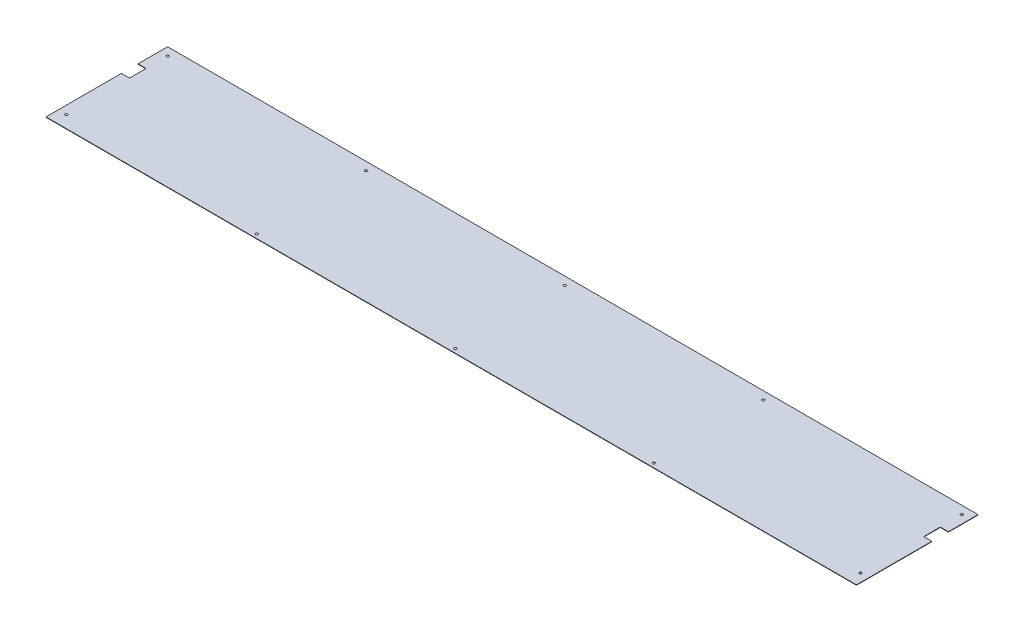
from build123d import *

# Parameters (mm, degrees)
SKETCH1_R           = 3
BOSS_EXTRUDE1_DEPTH = 1
CHAMFER1_SIZE       = 1


with BuildPart() as part:
    # Sketch1 → Boss-Extrude1 (new body)
    with BuildSketch(Plane(origin=(0, 0, 0), x_dir=(1, 0, 0), z_dir=(0, 1, 0))):
        Polygon((-1000, 88.5), (-980, 88.5), (-980, 47.5), (-1000, 47.5), (-1000, -138.5), (1000, -138.5), (1000, 47.5), (980, 47.5), (980, 88.5), (1000, 88.5), (1000, 158.5), (1000, 161.5), (-1000, 161.5), (-1000, 158.5), align=None)
        with Locations(Location((-980, 141.5, 0), (0, 0, 270))):
            Circle(SKETCH1_R, mode=Mode.SUBTRACT)
        with Locations(Location((980, 141.5, 0), (0, 0, 270))):
            Circle(SKETCH1_R, mode=Mode.SUBTRACT)
        with Locations(Location((0, 141.5, 0), (0, 0, 270))):
            Circle(SKETCH1_R, mode=Mode.SUBTRACT)
        with Locations(Location((490, 141.5, 0), (0, 0, 270))):
            Circle(SKETCH1_R, mode=Mode.SUBTRACT)
        with Locations(Location((-490, 141.5, 0), (0, 0, 270))):
            Circle(SKETCH1_R, mode=Mode.SUBTRACT)
        with Locations(Location((490, -128.5, 0), (0, 0, 270))):
            Circle(SKETCH1_R, mode=Mode.SUBTRACT)
        with Locations(Location((980, -108.5, 0), (0, 0, 270))):
            Circle(SKETCH1_R, mode=Mode.SUBTRACT)
        with Locations(Location((0, -128.5, 0), (0, 0, 270))):
            Circle(SKETCH1_R, mode=Mode.SUBTRACT)
        with Locations(Location((-490, -128.5, 0), (0, 0, 270))):
            Circle(SKETCH1_R, mode=Mode.SUBTRACT)
        with Locations(Location((-980, -108.5, 0), (0, 0, 270))):
            Circle(SKETCH1_R, mode=Mode.SUBTRACT)
    extrude(amount=BOSS_EXTRUDE1_DEPTH)

    # Chamfer1
    chamfer1_edges = [part.edges().sort_by_distance(p)[0] for p in [
        (-980, 0, -144.5),
        (980, 0, -144.5),
        (0, 0, -144.5),
        (490, 0, -144.5),
        (-490, 0, -144.5),
        (490, 0, 125.5),
        (980, 0, 105.5),
        (0, 0, 125.5),
        (-490, 0, 125.5),
        (-980, 0, 105.5),
    ]]
    chamfer(chamfer1_edges, length=CHAMFER1_SIZE - 0.0001)  # a hair under: the kernel refuses the full size


solid = part.part
